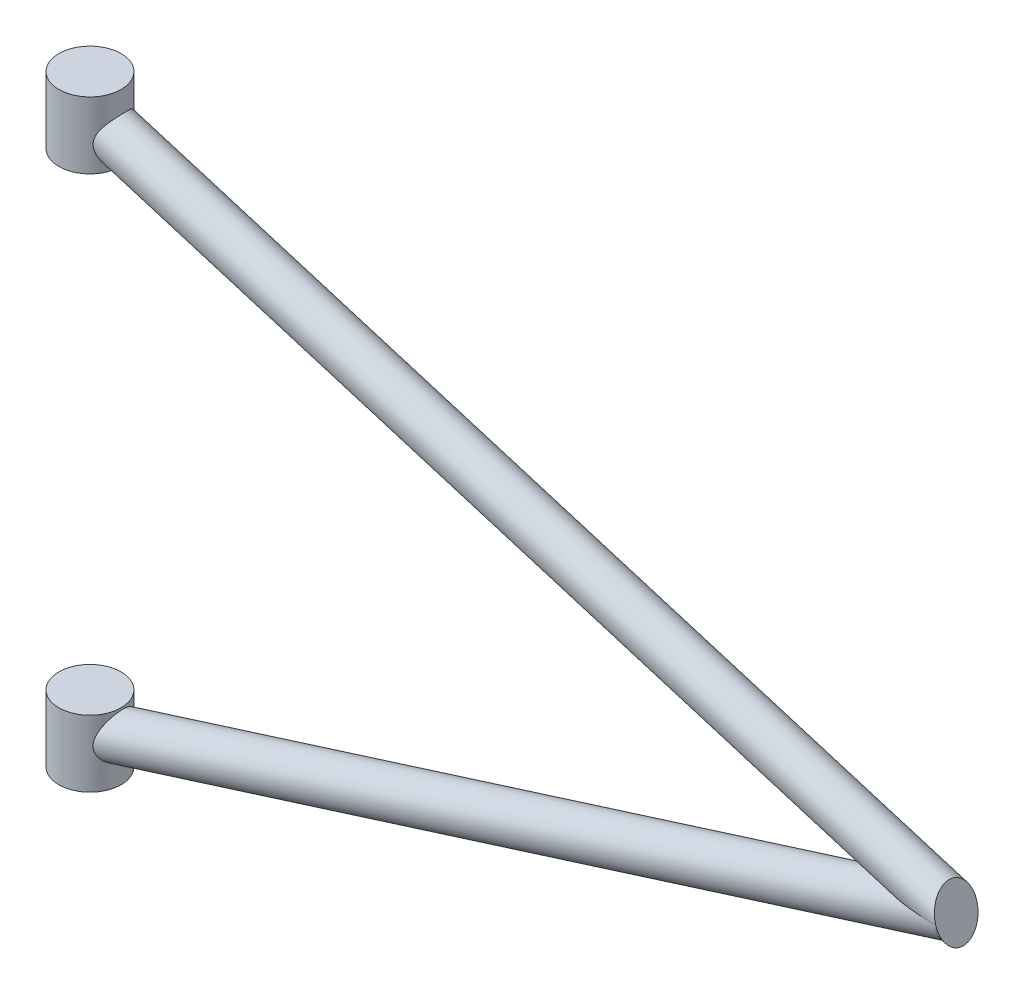
from build123d import *

# Parameters (mm, degrees)
SUSP_FR_LCA_FRONT_LEG_PROFILE_R  = 9.525
SUSP_FR_LCA_REAR_LEG_START       = 194.971257269
SUSP_FR_LCA_REAR_LEG_OUTLINE_R   = 9.525
SUSP_FR_LCA_REAR_LEG_DEPTH       = 392.368202981
SUSP_FR_LCA_REAR_LEG_START_2     = 587.33946025
SUSP_FR_LCA_REAR_LEG_2_OUTLINE_R = 9.525
SUSP_FR_LCA_REAR_LEG_2_DEPTH     = 13.53250199
SUSP_FR_LCA_REAR_LEG_START_3     = 523.39106775
SUSP_FR_LCA_REAR_LEG_3_OUTLINE_W = 26
SUSP_FR_LCA_REAR_LEG_3_OUTLINE_H = 23
SUSP_FR_LCA_REAR_LEG_3_DEPTH     = 11.60893225
SUSP_FR_LCA_BUSH_FRONT_PROFILE_R = 14
SUSP_FR_LCA_BUSH_REAR_PROFILE_R  = 14


with BuildPart() as part:
    # SUSP_FR_LCA_front_leg: sweep along a curve in space
    with BuildLine() as susp_fr_lca_front_leg_path:
        Line((205, -240.84, -42.383), (582, -130.461196, -55))
    # SUSP_FR_LCA_front_leg profile (on start of the path) → SUSP_FR_LCA_front_leg (sweep)
    with BuildSketch(Plane(origin=(205, -240.84, -42.383), x_dir=(-0.2809863080066093, 0.9597117768959672, 0), z_dir=(0.9592171404331008, 0.28084148736685866, -0.03210196992266429))):
        Circle(SUSP_FR_LCA_FRONT_LEG_PROFILE_R)
    sweep(path=susp_fr_lca_front_leg_path.line)

    # SUSP_FR_LCA_rear_leg: read off the stored shape, not the designer's step
    # SUSP_FR_LCA_rear_leg outline → SUSP_FR_LCA_rear_leg (add)
    with BuildSketch(Plane(origin=(0, 0, 0), x_dir=(0.3266773785489796, 0.9450726759891053, -0.01093286070332221), z_dir=(0.9445438654680327, -0.3268602715210149, -0.031610901725756396)).offset(SUSP_FR_LCA_REAR_LEG_START)):
        with Locations((67.432230038, -35.502420765)):
            Circle(SUSP_FR_LCA_REAR_LEG_OUTLINE_R)
    extrude(amount=SUSP_FR_LCA_REAR_LEG_DEPTH)

    # SUSP_FR_LCA_rear_leg 2 outline → SUSP_FR_LCA_rear_leg 2 (add)
    with BuildSketch(Plane(origin=(0, 0, 0), x_dir=(0.3266773785489796, 0.9450726759891053, -0.01093286070332221), z_dir=(0.9445438654680327, -0.3268602715210149, -0.031610901725756396)).offset(SUSP_FR_LCA_REAR_LEG_START_2)):
        with Locations((67.432230038, -35.502420765)):
            Circle(SUSP_FR_LCA_REAR_LEG_2_OUTLINE_R)
    extrude(amount=SUSP_FR_LCA_REAR_LEG_2_DEPTH)

    # SUSP_FR_LCA_rear_leg 3 outline → SUSP_FR_LCA_rear_leg 3 (cut)
    with BuildSketch(Plane(origin=(0, 0, 0), x_dir=(-0.28068434396715386, 0.959754165905817, 0.009393619012821172), z_dir=(0.9592171404331008, 0.2808414873668589, -0.03210196992266429)).offset(SUSP_FR_LCA_REAR_LEG_START_3)):
        with Locations((-289, -35.5)):
            Rectangle(SUSP_FR_LCA_REAR_LEG_3_OUTLINE_W, SUSP_FR_LCA_REAR_LEG_3_OUTLINE_H)
    extrude(amount=SUSP_FR_LCA_REAR_LEG_3_DEPTH, mode=Mode.SUBTRACT)

    # SUSP_FR_LCA_bush_front: sweep along a curve in space
    with BuildLine() as susp_fr_lca_bush_front_path:
        Line((205, -255.84, -42.383), (205, -225.84, -42.383))
    # SUSP_FR_LCA_bush_front profile (on start of the path) → SUSP_FR_LCA_bush_front (sweep)
    with BuildSketch(Plane(origin=(205, -255.84, -42.383), x_dir=(0, 0, 1), z_dir=(0, 1, 0))):
        Circle(SUSP_FR_LCA_BUSH_FRONT_PROFILE_R)
    sweep(path=susp_fr_lca_bush_front_path.line)

    # SUSP_FR_LCA_bush_rear: sweep along a curve in space
    with BuildLine() as susp_fr_lca_bush_rear_path:
        Line((205, -15, -42.383), (205, 15, -42.383))
    # SUSP_FR_LCA_bush_rear profile (on start of the path) → SUSP_FR_LCA_bush_rear (sweep)
    with BuildSketch(Plane(origin=(205, -15, -42.383), x_dir=(0, 0, 1), z_dir=(0, 1, 0))):
        Circle(SUSP_FR_LCA_BUSH_REAR_PROFILE_R)
    sweep(path=susp_fr_lca_bush_rear_path.line)


solid = part.part
